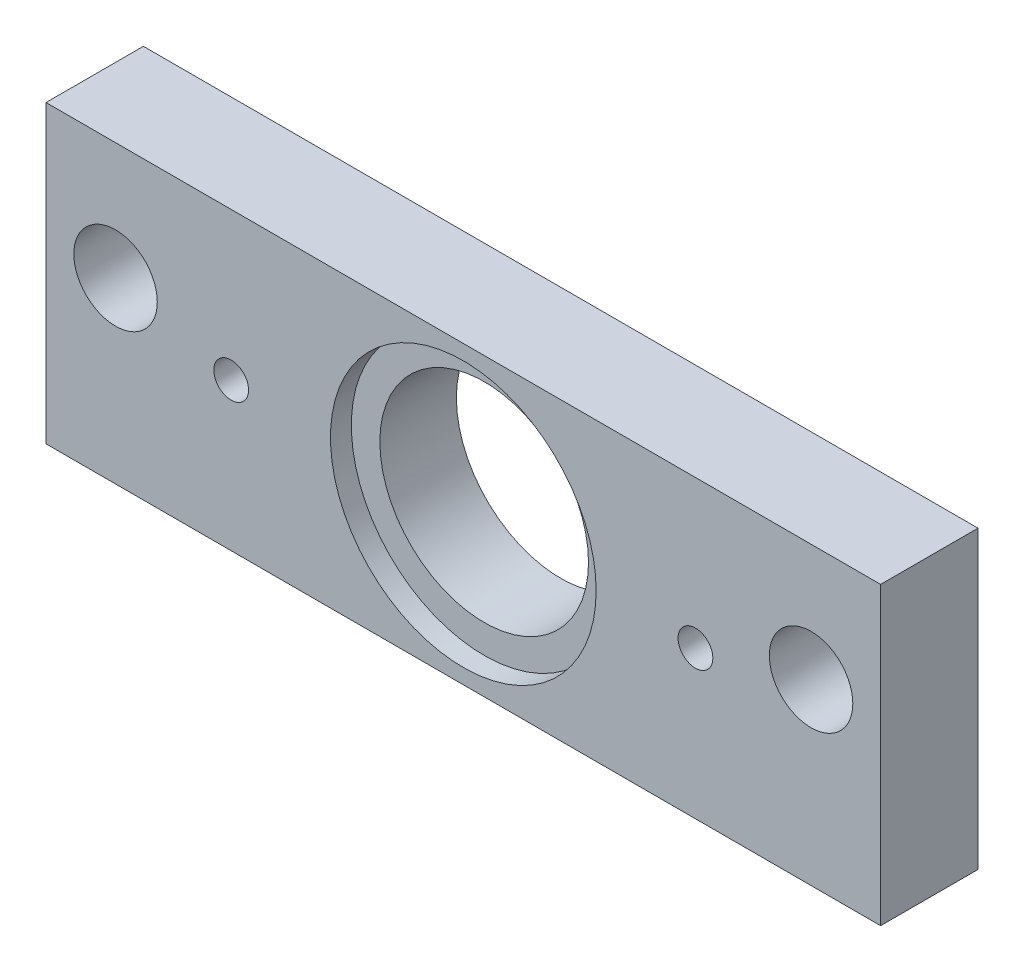
from build123d import *

# Parameters (mm, degrees)
SKETCH1_W           = 120
SKETCH1_H           = 42.5
BOSS_EXTRUDE1_DEPTH = 7
SKETCH2_R           = 19.1
CUT_EXTRUDE1_DEPTH  = 3
SKETCH3_R           = 15
CUT_EXTRUDE2_DEPTH  = 65.595375221
SKETCH4_R           = 2.5
CUT_EXTRUDE3_DEPTH  = 66.173326599
SKETCH5_R           = 6
CUT_EXTRUDE4_DEPTH  = 66.173326599
SKETCH6_R           = 2.5
SKETCH6_R_2         = 1.25
CUT_EXTRUDE5_DEPTH  = 10


with BuildPart() as part:
    # Sketch1 → Boss-Extrude1 (new, symmetric)
    with BuildSketch(Plane.XY):
        Rectangle(SKETCH1_W, SKETCH1_H)
    extrude(amount=BOSS_EXTRUDE1_DEPTH, both=True)

    # Sketch2 → Cut-Extrude1 (cut)
    with BuildSketch(Plane.XY.offset(7)):
        Circle(SKETCH2_R)
    extrude(amount=-CUT_EXTRUDE1_DEPTH, mode=Mode.SUBTRACT)

    # Sketch3 → Cut-Extrude2 (cut, through all)
    with BuildSketch(Plane.XY.offset(4)):
        Circle(SKETCH3_R)
    extrude(amount=-CUT_EXTRUDE2_DEPTH, mode=Mode.SUBTRACT)

    # Sketch4 → Cut-Extrude3 (cut, through all)
    with BuildSketch(Plane.XY.offset(7)):
        with Locations((-33.375, 0)):
            Circle(SKETCH4_R)
        with Locations((33.375, 0)):
            Circle(SKETCH4_R)
    extrude(amount=-CUT_EXTRUDE3_DEPTH, mode=Mode.SUBTRACT)

    # Sketch5 → Cut-Extrude4 (cut, through all)
    with BuildSketch(Plane.XY.offset(7)):
        with Locations((-50, 4.4)):
            Circle(SKETCH5_R)
        with Locations((50, 4.4)):
            Circle(SKETCH5_R)
    extrude(amount=-CUT_EXTRUDE4_DEPTH, mode=Mode.SUBTRACT)

    # Sketch6 → Cut-Extrude5 (cut)
    with BuildSketch(Plane.XZ.offset(21.25)):
        with Locations((-50, 0)):
            Circle(SKETCH6_R)
        with Locations((-25, 0)):
            Circle(SKETCH6_R)
        with Locations((25, 0)):
            Circle(SKETCH6_R)
        with Locations((50, 0)):
            Circle(SKETCH6_R)
        with Locations((-37.5, 0)):
            Circle(SKETCH6_R_2)
        with Locations((37.5, 0)):
            Circle(SKETCH6_R_2)
    extrude(amount=-CUT_EXTRUDE5_DEPTH, mode=Mode.SUBTRACT)


solid = part.part
